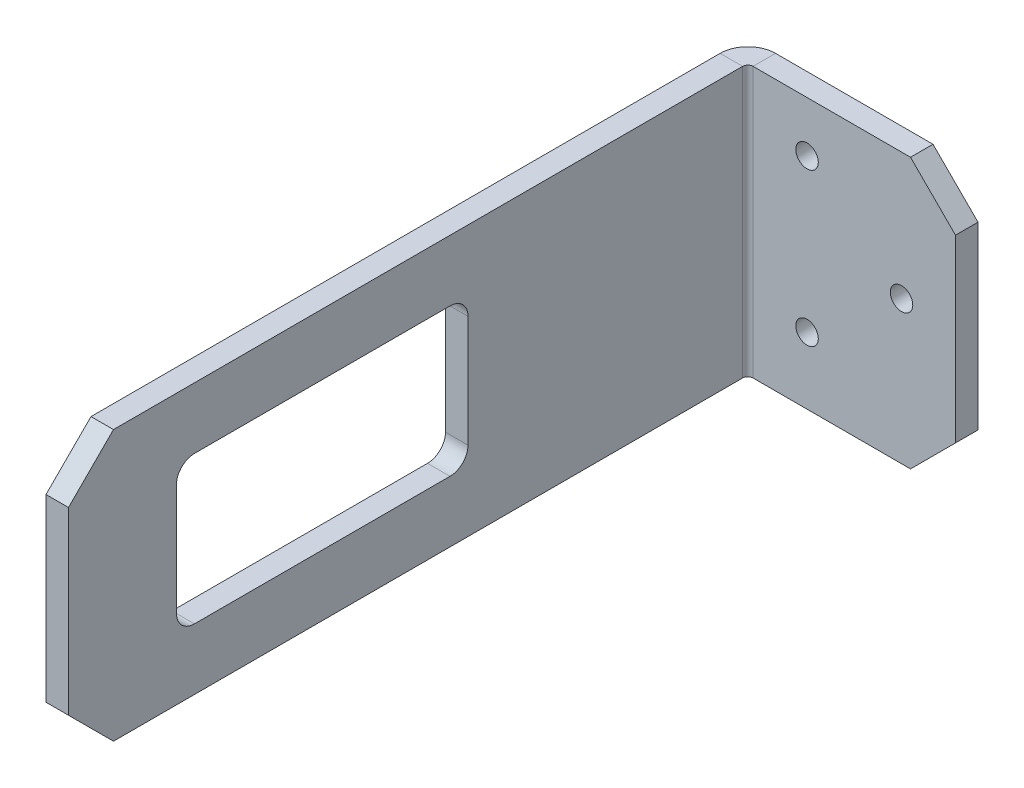
from build123d import *

# Parameters (mm, degrees)
SKETCH1_W                 = 28.575
SKETCH1_H                 = 38.1
BASE_FLANGE1_DEPTH        = 3.175
EDGE_FLANGE1_DEPTH        = 38.1
BREAK_CORNER1_START       = 42.656216575
BREAK_CORNER1_OUTLINE_W   = 32
BREAK_CORNER1_OUTLINE_H   = 6
BREAK_CORNER1_DEPTH       = 4.490128061
BREAK_CORNER1_START_2     = 15.715448212
BREAK_CORNER1_2_OUTLINE_W = 32
BREAK_CORNER1_2_OUTLINE_H = 6
BREAK_CORNER1_2_DEPTH     = 4.49012806
BREAK_CORNER1_START_3     = 90.251574017
BREAK_CORNER1_3_OUTLINE_W = 6
BREAK_CORNER1_3_OUTLINE_H = 32
BREAK_CORNER1_3_DEPTH     = 4.49012806
BREAK_CORNER1_START_4     = -67.800933714
BREAK_CORNER1_4_OUTLINE_W = 6
BREAK_CORNER1_4_OUTLINE_H = 31
BREAK_CORNER1_4_DEPTH     = 4.49012806
CUT_EXTRUDE1_REACH        = 110.171
CUT_EXTRUDE2_REACH        = 109.061
SKETCH10_R                = 1.5875


# Read off the part's stored shape, not the designer's step: Break-Corner1
# Sheet-metal steps are written as plain solids
with BuildPart() as part:
    # Sketch1 → Base-Flange1 (new body)
    with BuildSketch(Plane.XY):
        with Locations((14.2875, 19.05)):
            Rectangle(SKETCH1_W, SKETCH1_H)
    extrude(amount=-BASE_FLANGE1_DEPTH)

    # Edge-Flange1 section (across the edge) → Edge-Flange1 (add)
    with BuildSketch(Plane(origin=(-0.7366, 38.1, 0), x_dir=(1, 0, 0), z_dir=(0, -1, 0))):
        with BuildLine():
            Line((-3.175, 0.7366), (-3.175, 95.885))
            Line((-3.175, 95.885), (0, 95.885))
            Line((0, 95.885), (0, 0.7366))
            ThreePointArc((0, 0.7366), (0.215745145, 0.215745145), (0.7366, 0))
            Line((0.7366, 0), (0.7366, -3.175))
            ThreePointArc((0.7366, -3.175), (-2.029318885, -2.029318885), (-3.175, 0.7366))
        make_face()
    extrude(amount=EDGE_FLANGE1_DEPTH)

    # Break-Corner1 outline → Break-Corner1 (cut)
    with BuildSketch(Plane(origin=(0, 0, 0), x_dir=(0.707106781186548, -0.707106781186547, 0), z_dir=(0.707106781186547, 0.707106781186548, 0)).offset(BREAK_CORNER1_START)):
        with Locations((3, 2)):
            Rectangle(BREAK_CORNER1_OUTLINE_W, BREAK_CORNER1_OUTLINE_H)
    extrude(amount=BREAK_CORNER1_DEPTH, mode=Mode.SUBTRACT)

    # Break-Corner1 2 outline → Break-Corner1 2 (cut)
    with BuildSketch(Plane(origin=(0, 0, 0), x_dir=(0.707106781186548, 0.707106781186547, 0), z_dir=(0.707106781186547, -0.707106781186548, 0)).offset(BREAK_CORNER1_START_2)):
        with Locations((30, -2)):
            Rectangle(BREAK_CORNER1_2_OUTLINE_W, BREAK_CORNER1_2_OUTLINE_H)
    extrude(amount=BREAK_CORNER1_2_DEPTH, mode=Mode.SUBTRACT)

    # Break-Corner1 3 outline → Break-Corner1 3 (cut)
    with BuildSketch(Plane(origin=(0, 0, 0), x_dir=(1, 0, 0), z_dir=(0, 0.707106781186548, 0.707106781186547)).offset(BREAK_CORNER1_START_3)):
        with Locations((-2, -51)):
            Rectangle(BREAK_CORNER1_3_OUTLINE_W, BREAK_CORNER1_3_OUTLINE_H)
    extrude(amount=BREAK_CORNER1_3_DEPTH, mode=Mode.SUBTRACT)

    # Break-Corner1 4 outline → Break-Corner1 4 (cut)
    with BuildSketch(Plane(origin=(0, 0, 0), x_dir=(1, 0, 0), z_dir=(0, 0.707106781186548, -0.707106781186547)).offset(BREAK_CORNER1_START_4)):
        with Locations((-2, -77.5)):
            Rectangle(BREAK_CORNER1_4_OUTLINE_W, BREAK_CORNER1_4_OUTLINE_H)
    extrude(amount=BREAK_CORNER1_4_DEPTH, mode=Mode.SUBTRACT)

    # Sketch9 → Cut-Extrude1 (cut, up to next)
    with BuildSketch(Plane.ZY.offset(3.9116), mode=Mode.PRIVATE) as cut_extrude1_sk1:
        with BuildLine():
            Line((42.037, 8.636), (78.105, 8.636))
            ThreePointArc((78.105, 8.636), (79.901051224, 9.379948776), (80.645, 11.176))
            Line((80.645, 11.176), (80.645, 26.924))
            ThreePointArc((80.645, 26.924), (79.901051224, 28.720051224), (78.105, 29.464))
            Line((78.105, 29.464), (42.037, 29.464))
            ThreePointArc((42.037, 29.464), (40.240948776, 28.720051224), (39.497, 26.924))
            Line((39.497, 26.924), (39.497, 11.176))
            ThreePointArc((39.497, 11.176), (40.240948776, 9.379948776), (42.037, 8.636))
        make_face()
    cut_extrude1_tool1 = extrude(cut_extrude1_sk1.sketch, amount=-CUT_EXTRUDE1_REACH, mode=Mode.PRIVATE) & part.part
    add(cut_extrude1_tool1.solids().sort_by_distance((-3.9116, 19.05, 60.071))[0], mode=Mode.SUBTRACT)

    # Sketch10 → Cut-Extrude2 (cut, up to next)
    with BuildSketch(Plane.XY, mode=Mode.PRIVATE) as cut_extrude2_sk1:
        with Locations((7.62, 30.96264399)):
            Circle(SKETCH10_R)
    cut_extrude2_tool1 = extrude(cut_extrude2_sk1.sketch, amount=-CUT_EXTRUDE2_REACH, mode=Mode.PRIVATE) & part.part
    # Sketch10 → Cut-Extrude2 (cut, up to next)
    with BuildSketch(Plane.XY, mode=Mode.PRIVATE) as cut_extrude2_sk2:
        with Locations((20.955, 20.183863844)):
            Circle(SKETCH10_R)
    cut_extrude2_tool2 = extrude(cut_extrude2_sk2.sketch, amount=-CUT_EXTRUDE2_REACH, mode=Mode.PRIVATE) & part.part
    # Sketch10 → Cut-Extrude2 (cut, up to next)
    with BuildSketch(Plane.XY, mode=Mode.PRIVATE) as cut_extrude2_sk3:
        with Locations((7.62, 9.405083697)):
            Circle(SKETCH10_R)
    cut_extrude2_tool3 = extrude(cut_extrude2_sk3.sketch, amount=-CUT_EXTRUDE2_REACH, mode=Mode.PRIVATE) & part.part
    add(cut_extrude2_tool1.solids().sort_by_distance((7.62, 30.962644, 0))[0], mode=Mode.SUBTRACT)
    add(cut_extrude2_tool2.solids().sort_by_distance((20.955, 20.183864, 0))[0], mode=Mode.SUBTRACT)
    add(cut_extrude2_tool3.solids().sort_by_distance((7.62, 9.405084, 0))[0], mode=Mode.SUBTRACT)


solid = part.part
